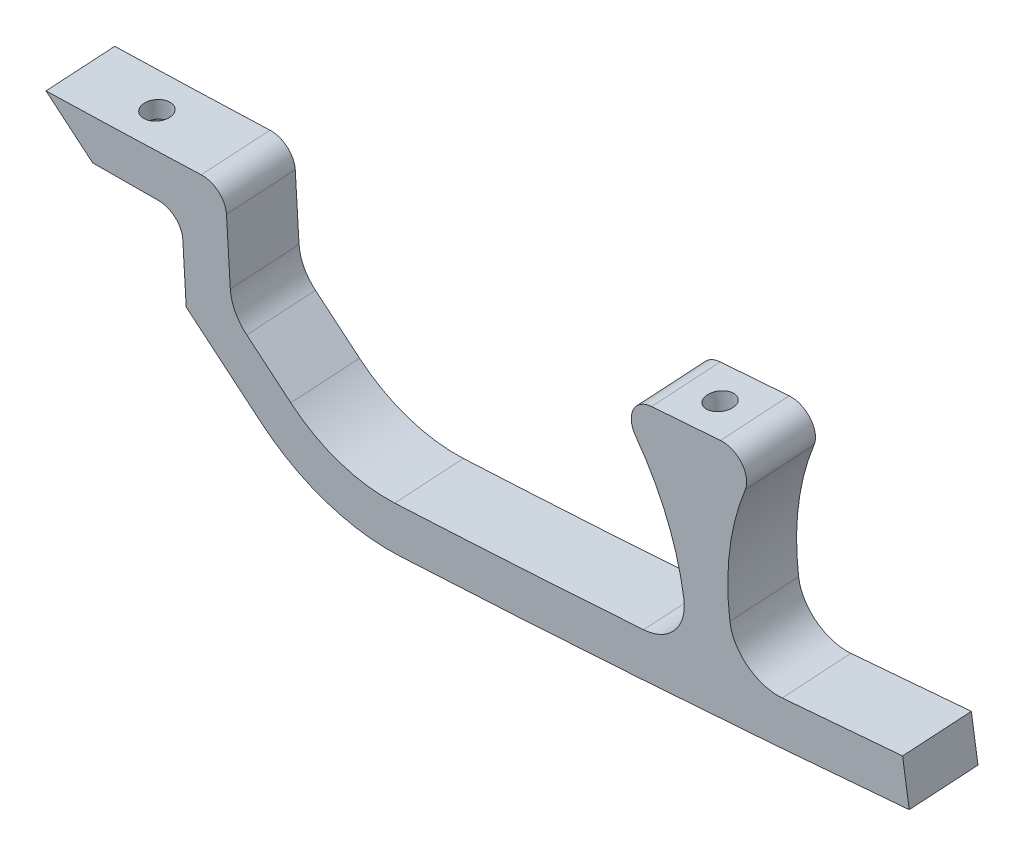
from build123d import *

# Parameters (mm, degrees)
BOSS_EXTRUDE1_START     = -4.7625
BOSS_EXTRUDE1_DEPTH     = 9.525
SKETCH4_R               = 3.175
CUT_EXTRUDE1_DEPTH      = 3.556
SKETCH5_R               = 1.778
CUT_EXTRUDE2_DEPTH      = 3.556
SKETCH6_R               = 1.778
CUT_EXTRUDE3_DEPTH      = 395.764920194
CUT_EXTRUDE4_DEPTH      = 3.556
CUT_EXTRUDE4_DEPTH_BACK = 394.514669922
SKETCH7_R               = 3.175
SKETCH7_R_2             = 1.778


# Read off the part's stored shape, not the designer's step: Boss-Extrude1
with BuildPart() as part:
    # Boss-Extrude1 outline → Boss-Extrude1 (new body)
    with BuildSketch(Plane(origin=(-0.301955496, 3.66953177, -64.525155836), x_dir=(-0.9999890865713076, -0.0002652643419205306, 0.004664372745720222), z_dir=(-0.004671909489919135, 0.056775652550269534, -0.9983760306313494)).offset(BOSS_EXTRUDE1_START)):
        with BuildLine():
            ThreePointArc((351.090571083, -55.300504742), (344.645589293, -59.305920537), (337.148393987, -60.477760333))
            add(Edge.make_bspline(
                [(302.92001028, -58.493795672), (304.509330321, -58.60122978), (315.913860098, -59.356827376), (327.324538226, -60.002876959), (337.148393987, -60.477760333)],
                knots=[0.283817359, 0.283817359, 0.283817359, 0.283817359, 0.321763123, 0.55608803, 0.55608803, 0.55608803, 0.55608803], degree=3))
            ThreePointArc((302.92001028, -58.493795672), (298.540134178, -56.306049329), (297.01844307, -51.652662937))
            ThreePointArc((297.01844307, -51.652662937), (298.817944258, -42.742557946), (302.676848033, -34.512306606))
            ThreePointArc((302.676848033, -34.512306606), (302.812285866, -31.389489502), (300.205974442, -29.663954561))
            add(Edge.make_bspline(
                [(290.723349608, -28.971987248), (293.88384664, -29.211203734), (297.044721601, -29.441859136), (300.205974442, -29.663954561)],
                knots=[0.169565869, 0.169565869, 0.169565869, 0.169565869, 0.246277706, 0.246277706, 0.246277706, 0.246277706], degree=3))
            ThreePointArc((290.723349608, -28.971987248), (287.894150829, -30.300881632), (287.574810624, -33.410278334))
            ThreePointArc((287.574810624, -33.410278334), (290.198038966, -42.113548005), (290.684983891, -51.190503181))
            ThreePointArc((290.684983891, -51.190503181), (288.503875799, -55.573685628), (283.852803221, -57.102425178))
            add(Edge.make_bspline(
                [(267.2739472, -55.725885072), (271.414101546, -56.089029226), (276.943487963, -56.55461635), (282.47093841, -56.994157025), (283.852803221, -57.102425178)],
                knots=[0, 0, 0, 0, 0.09902591, 0.132034547, 0.132034547, 0.132034547, 0.132034547], degree=3))
            Line((267.2739472, -55.725885072), (266.719101765, -62.051598198))
            add(Edge.make_bspline(
                [(266.719101765, -62.051598198), (285.372886056, -63.687772151), (308.740732669, -65.369335536), (332.113756278, -66.591725825), (336.786834388, -66.817774574)],
                knots=[0, 0, 0, 0, 0.444589519, 0.555671616, 0.555671616, 0.555671616, 0.555671616], degree=3))
            ThreePointArc((336.786834388, -66.817774574), (346.821832777, -65.271443631), (355.449407296, -59.918193219))
            Line((355.449407296, -59.918193219), (365.162167793, -50.749897782))
            Line((365.162167793, -50.749897782), (365.162167793, -42.440188824))
            ThreePointArc((365.162167793, -42.440188824), (366.092103763, -40.195124794), (368.337167793, -39.265188824))
            Line((368.337167793, -39.265188824), (377.328903503, -39.265188824))
            Line((377.328903503, -39.265188824), (383.403102119, -33.531489588))
            add(Edge.make_bspline(
                [(362.097911235, -32.917120768), (369.197743206, -33.164912437), (376.299473684, -33.369697882), (383.403102119, -33.531489588)],
                knots=[0.746516847, 0.746516847, 0.746516847, 0.746516847, 0.918535276, 0.918535276, 0.918535276, 0.918535276], degree=3))
            ThreePointArc((362.097911235, -32.917120768), (359.781604988, -33.806306666), (358.812167793, -36.090188824))
            Line((358.812167793, -36.090188824), (358.812167793, -45.273612359))
            ThreePointArc((358.812167793, -45.273612359), (358.293167277, -47.787960192), (356.821004007, -49.891300836))
            Line((356.821004007, -49.891300836), (351.090571083, -55.300504742))
        make_face()
    extrude(amount=BOSS_EXTRUDE1_DEPTH)

    # Sketch4 → Cut-Extrude1 (cut)
    with BuildSketch(Plane(origin=(4.22e-07, -39.201736636, -2.229324535), x_dir=(-1.0, -1.0737029140643802e-08, -6.106056819647095e-10), z_dir=(1.0754377437384831e-08, -0.9983869264530261, -0.056776272224230304))):
        with Locations(Location((373.181715938, 62.871576923, 0), (0, 0, 90))):
            Circle(SKETCH4_R)
    extrude(amount=-CUT_EXTRUDE1_DEPTH, mode=Mode.SUBTRACT)

    # Sketch5 → Cut-Extrude2 (cut)
    with BuildSketch(Plane(origin=(3.84e-07, -35.651472726, -2.027428111), x_dir=(-1.0, -1.0737029140643802e-08, -6.106056819647096e-10), z_dir=(1.0754377437384831e-08, -0.9983869264530261, -0.0567762722242303))):
        with Locations(Location((373.181715938, 62.871576923, 0), (0, 0, 90))):
            Circle(SKETCH5_R)
    extrude(amount=-CUT_EXTRUDE2_DEPTH, mode=Mode.SUBTRACT)

    # Sketch6 → Cut-Extrude3 (cut, through all)
    with BuildSketch(Plane(origin=(0.563052915, -7.70348677, -0.440716731), x_dir=(0.9973481775659092, 0.07265901361084529, 0.004156975710635213), z_dir=(-0.07277783114339942, 0.995720018948314, 0.05696517497236669))):
        with Locations(Location((-297.136682759, 63.2214344, 0), (0, 0, 180.238565242))):
            Circle(SKETCH6_R)
    extrude(amount=-CUT_EXTRUDE3_DEPTH, mode=Mode.SUBTRACT)

    # Sketch7 → Cut-Extrude4 (cut, two sides: drawn at the far end of the back side and taken through both)
    # profile 1 of 2: a face of its own
    with BuildSketch(Plane(origin=(3.104818668, -42.479008432, -2.430225467), x_dir=(0.9973481775659092, 0.07265901361084529, 0.004156975710635213), z_dir=(-0.07277783114339942, 0.995720018948314, 0.05696517497236669)).offset(-CUT_EXTRUDE4_DEPTH_BACK)):
        with Locations(Location((-297.136682759, 63.2214344, 0), (0, 0, 180.238565242))):
            Circle(SKETCH7_R)
        with Locations(Location((-297.136682759, 63.2214344, 0), (0, 0, 180.238565242))):
            Circle(SKETCH7_R_2, mode=Mode.SUBTRACT)
    # profile 2 of 2: a face of its own
    with BuildSketch(Plane(origin=(3.104818668, -42.479008432, -2.430225467), x_dir=(0.9973481775659092, 0.07265901361084529, 0.004156975710635213), z_dir=(-0.07277783114339942, 0.995720018948314, 0.05696517497236669)).offset(-CUT_EXTRUDE4_DEPTH_BACK)):
        with Locations(Location((-297.136682759, 63.2214344, 0), (0, 0, 180.238565242))):
            Circle(SKETCH7_R_2)
    extrude(amount=CUT_EXTRUDE4_DEPTH + CUT_EXTRUDE4_DEPTH_BACK, mode=Mode.SUBTRACT)


solid = part.part
